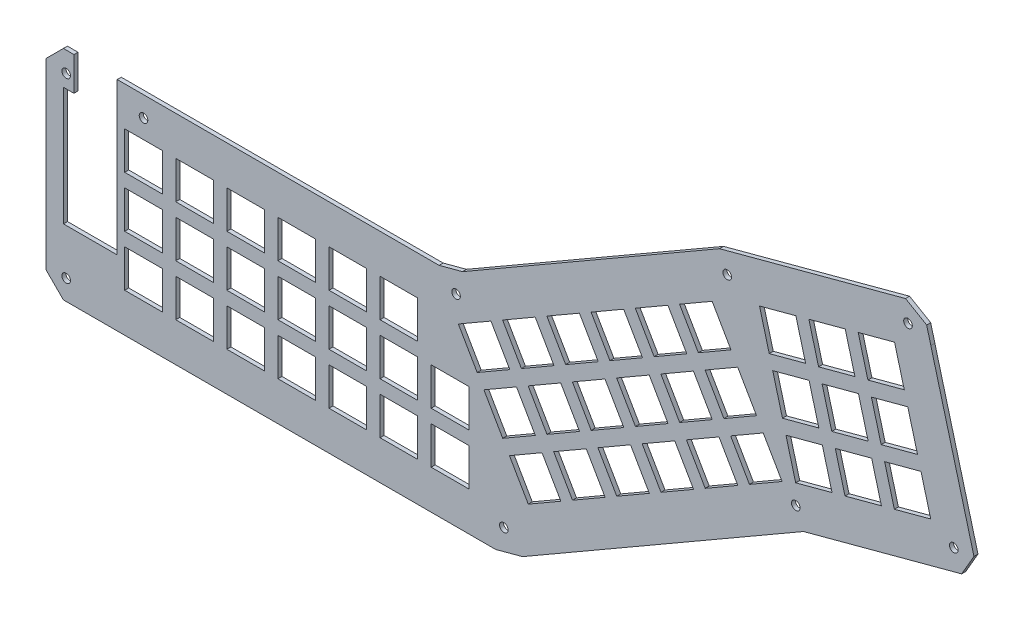
from build123d import *

# Parameters (mm, degrees)
ESQUISSE1_R        = 1.6
ESQUISSE1_W        = 14
ESQUISSE1_H        = 14
BOSS_EXTRU_1_DEPTH = 1.5


with BuildPart() as part:
    # Esquisse1 → Boss.-Extru.1 (new body)
    with BuildSketch(Plane.XY):
        Polygon((-76.753762562, 39.085106383), (-76.758646329, 39.085106383), (-76.758646329, 51.585106383), (-75.988646329, 51.585106383), (42.975455994, 51.585106383), (51.669750275, 53.914735514), (147.250925797, 109.098552931), (210.540810955, 126.057026548), (216.430520531, 127.635169473), (224.324263617, 123.047292559), (225.851989006, 117.211223452), (230.508864659, 99.83152691), (241.906099495, 57.296467436), (237.335031683, 49.379145741), (178.515758799, 33.618569072), (73.963816863, -26.744522748), (63.997857106, -29.414893617), (-96.789296468, -29.414893617), (-103.253762562, -22.950427523), (-103.253762562, 35.79522772), (-103.253762562, 45.120640289), (-96.789296468, 51.585106383), (-92.863762562, 51.585106383), (-92.863762562, 39.085106383), (-96.753762562, 39.085106383), (-96.753762562, -4.914893617), (-76.753762562, -4.914893617), align=None)
        with Locations((-95.753762562, 44.085106383)):
            Circle(ESQUISSE1_R, mode=Mode.SUBTRACT)
        with Locations((-66.988646329, 44.085106383)):
            Circle(ESQUISSE1_R, mode=Mode.SUBTRACT)
        with Locations((-95.753762562, -21.914893617)):
            Circle(ESQUISSE1_R, mode=Mode.SUBTRACT)
        with Locations((67.039694146, -20.835264486)):
            Circle(ESQUISSE1_R, mode=Mode.SUBTRACT)
        with Locations((49.263745973, 45.505477252)):
            Circle(ESQUISSE1_R, mode=Mode.SUBTRACT)
        with Locations((175.637377655, 40.567595866)):
            Circle(ESQUISSE1_R, mode=Mode.SUBTRACT)
        with Locations((150.12930694, 102.149526137)):
            Circle(ESQUISSE1_R, mode=Mode.SUBTRACT)
        with Locations((217.363403759, 120.120565138)):
            Circle(ESQUISSE1_R, mode=Mode.SUBTRACT)
        with Locations((234.393639901, 56.355573542)):
            Circle(ESQUISSE1_R, mode=Mode.SUBTRACT)
        with Locations((-66.988646329, 11.085106383)):
            Rectangle(ESQUISSE1_W, ESQUISSE1_H, mode=Mode.SUBTRACT)
        with Locations((-66.988646329, 30.085106383)):
            Rectangle(ESQUISSE1_W, ESQUISSE1_H, mode=Mode.SUBTRACT)
        with Locations((-66.988646329, -7.914893617)):
            Rectangle(ESQUISSE1_W, ESQUISSE1_H, mode=Mode.SUBTRACT)
        with Locations((-47.988646329, 11.085106383)):
            Rectangle(ESQUISSE1_W, ESQUISSE1_H, mode=Mode.SUBTRACT)
        with Locations((-47.988646329, 30.085106383)):
            Rectangle(ESQUISSE1_W, ESQUISSE1_H, mode=Mode.SUBTRACT)
        with Locations((-47.988646329, -7.914893617)):
            Rectangle(ESQUISSE1_W, ESQUISSE1_H, mode=Mode.SUBTRACT)
        with Locations((-28.988646329, 11.085106383)):
            Rectangle(ESQUISSE1_W, ESQUISSE1_H, mode=Mode.SUBTRACT)
        with Locations((-28.988646329, 30.085106383)):
            Rectangle(ESQUISSE1_W, ESQUISSE1_H, mode=Mode.SUBTRACT)
        with Locations((-28.988646329, -7.914893617)):
            Rectangle(ESQUISSE1_W, ESQUISSE1_H, mode=Mode.SUBTRACT)
        with Locations((-9.988646329, 11.085106383)):
            Rectangle(ESQUISSE1_W, ESQUISSE1_H, mode=Mode.SUBTRACT)
        with Locations((-9.988646329, 30.085106383)):
            Rectangle(ESQUISSE1_W, ESQUISSE1_H, mode=Mode.SUBTRACT)
        with Locations((-9.988646329, -7.914893617)):
            Rectangle(ESQUISSE1_W, ESQUISSE1_H, mode=Mode.SUBTRACT)
        with Locations((9.011353671, 11.085106383)):
            Rectangle(ESQUISSE1_W, ESQUISSE1_H, mode=Mode.SUBTRACT)
        with Locations((9.011353671, 30.085106383)):
            Rectangle(ESQUISSE1_W, ESQUISSE1_H, mode=Mode.SUBTRACT)
        with Locations((9.011353671, -7.914893617)):
            Rectangle(ESQUISSE1_W, ESQUISSE1_H, mode=Mode.SUBTRACT)
        with Locations((28.011353671, 11.085106383)):
            Rectangle(ESQUISSE1_W, ESQUISSE1_H, mode=Mode.SUBTRACT)
        with Locations((28.011353671, 30.085106383)):
            Rectangle(ESQUISSE1_W, ESQUISSE1_H, mode=Mode.SUBTRACT)
        with Locations((28.011353671, -7.914893617)):
            Rectangle(ESQUISSE1_W, ESQUISSE1_H, mode=Mode.SUBTRACT)
        with Locations((47.011353671, 11.085106383)):
            Rectangle(ESQUISSE1_W, ESQUISSE1_H, mode=Mode.SUBTRACT)
        with Locations((47.011353671, -7.914893617)):
            Rectangle(ESQUISSE1_W, ESQUISSE1_H, mode=Mode.SUBTRACT)
        Polygon((69.12536992, 3.37096395), (76.12536992, -8.753391703), (88.249725572, -1.753391703), (81.249725572, 10.37096395), align=None, mode=Mode.SUBTRACT)
        Polygon((59.62536992, 19.825446622), (66.62536992, 7.701090969), (78.749725572, 14.701090969), (71.749725572, 26.825446622), align=None, mode=Mode.SUBTRACT)
        Polygon((50.12536992, 36.279929294), (57.12536992, 24.155573641), (69.249725572, 31.155573641), (62.249725572, 43.279929294), align=None, mode=Mode.SUBTRACT)
        Polygon((85.579852591, 12.87096395), (92.579852591, 0.746608297), (104.704208244, 7.746608297), (97.704208244, 19.87096395), align=None, mode=Mode.SUBTRACT)
        Polygon((76.079852591, 29.325446622), (83.079852591, 17.201090969), (95.204208244, 24.201090969), (88.204208244, 36.325446622), align=None, mode=Mode.SUBTRACT)
        Polygon((66.579852591, 45.779929294), (73.579852591, 33.655573641), (85.704208244, 40.655573641), (78.704208244, 52.779929294), align=None, mode=Mode.SUBTRACT)
        Polygon((102.034335263, 22.37096395), (109.034335263, 10.246608297), (121.158690916, 17.246608297), (114.158690916, 29.37096395), align=None, mode=Mode.SUBTRACT)
        Polygon((92.534335263, 38.825446622), (99.534335263, 26.701090969), (111.658690916, 33.701090969), (104.658690916, 45.825446622), align=None, mode=Mode.SUBTRACT)
        Polygon((83.034335263, 55.279929294), (90.034335263, 43.155573641), (102.158690916, 50.155573641), (95.158690916, 62.279929294), align=None, mode=Mode.SUBTRACT)
        Polygon((118.488817935, 31.87096395), (125.488817935, 19.746608297), (137.613173588, 26.746608297), (130.613173588, 38.87096395), align=None, mode=Mode.SUBTRACT)
        Polygon((108.988817935, 48.325446622), (115.988817935, 36.201090969), (128.113173588, 43.201090969), (121.113173588, 55.325446622), align=None, mode=Mode.SUBTRACT)
        Polygon((99.488817935, 64.779929294), (106.488817935, 52.655573641), (118.613173588, 59.655573641), (111.613173588, 71.779929294), align=None, mode=Mode.SUBTRACT)
        Polygon((134.943300607, 41.37096395), (141.943300607, 29.246608297), (154.06765626, 36.246608297), (147.06765626, 48.37096395), align=None, mode=Mode.SUBTRACT)
        Polygon((125.443300607, 57.825446622), (132.443300607, 45.701090969), (144.56765626, 52.701090969), (137.56765626, 64.825446622), align=None, mode=Mode.SUBTRACT)
        Polygon((115.943300607, 74.279929294), (122.943300607, 62.155573641), (135.06765626, 69.155573641), (128.06765626, 81.279929294), align=None, mode=Mode.SUBTRACT)
        Polygon((151.397783279, 50.87096395), (158.397783279, 38.746608297), (170.522138932, 45.746608297), (163.522138932, 57.87096395), align=None, mode=Mode.SUBTRACT)
        Polygon((141.897783279, 67.325446622), (148.897783279, 55.201090969), (161.022138932, 62.201090969), (154.022138932, 74.325446622), align=None, mode=Mode.SUBTRACT)
        Polygon((132.397783279, 83.779929294), (139.397783279, 71.655573641), (151.522138932, 78.655573641), (144.522138932, 90.779929294), align=None, mode=Mode.SUBTRACT)
        Polygon((167.051254346, 79.722282932), (180.574215914, 83.345749564), (184.197682546, 69.822787996), (170.674720978, 66.199321364), align=None, mode=Mode.SUBTRACT)
        Polygon((162.133692489, 98.074873632), (175.656654057, 101.698340263), (179.280120689, 88.175378695), (165.757159121, 84.551912064), align=None, mode=Mode.SUBTRACT)
        Polygon((171.968816203, 61.369692233), (185.491777771, 64.993158864), (189.115244403, 51.470197296), (175.592282834, 47.846730665), align=None, mode=Mode.SUBTRACT)
        Polygon((185.403845046, 84.639844789), (198.926806614, 88.263311421), (202.550273245, 74.740349853), (189.027311677, 71.116883221), align=None, mode=Mode.SUBTRACT)
        Polygon((180.486283189, 102.992435489), (194.009244757, 106.61590212), (197.632711388, 93.092940552), (184.10974982, 89.469473921), align=None, mode=Mode.SUBTRACT)
        Polygon((190.321406903, 66.28725409), (203.844368471, 69.910720721), (207.467835102, 56.387759153), (193.944873534, 52.764292522), align=None, mode=Mode.SUBTRACT)
        Polygon((203.756435745, 89.557406646), (217.279397313, 93.180873278), (220.902863945, 79.65791171), (207.379902377, 76.034445078), align=None, mode=Mode.SUBTRACT)
        Polygon((198.838873888, 107.909997346), (212.361835456, 111.533463977), (215.985302088, 98.010502409), (202.46234052, 94.387035778), align=None, mode=Mode.SUBTRACT)
        Polygon((208.673997602, 71.204815947), (222.19695917, 74.828282578), (225.820425801, 61.30532101), (212.297464233, 57.681854379), align=None, mode=Mode.SUBTRACT)
    extrude(amount=BOSS_EXTRU_1_DEPTH)


solid = part.part
